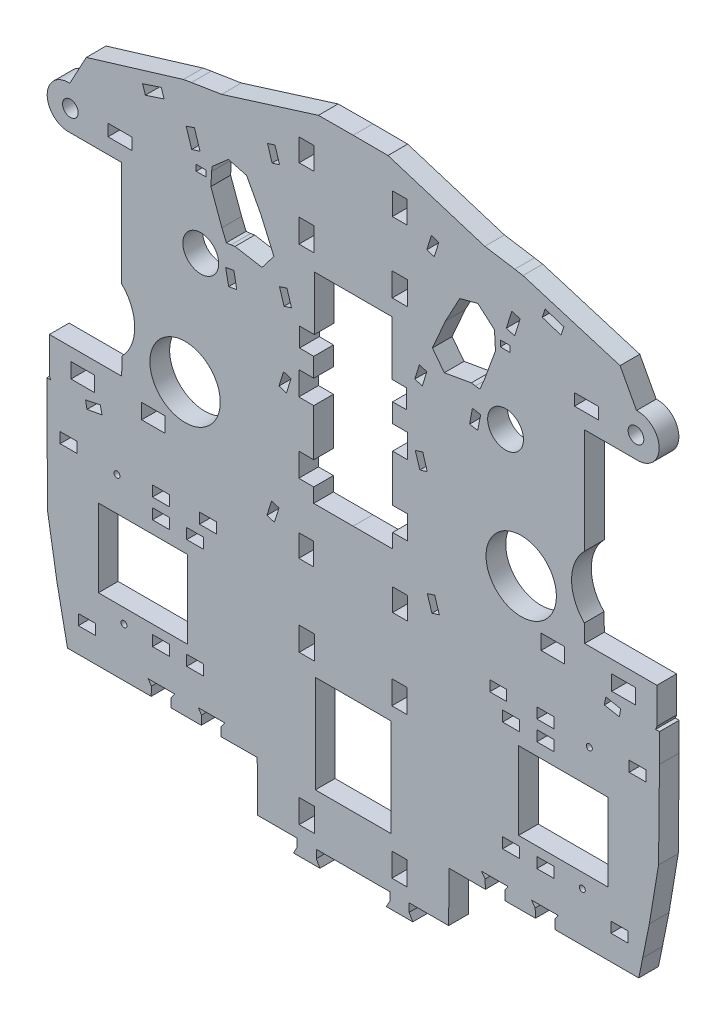
from build123d import *

# Parameters (mm, degrees)
SKETCH_2_R      = 1.524028207
SKETCH_2_R_2    = 1.524027374
SKETCH_2_R_3    = 17.842909586
SKETCH_2_R_4    = 9.091693683
SKETCH_2_R_5    = 3.983277078
SKETCH_2_W      = 7.746275654
SKETCH_2_H      = 11.929921146
SKETCH_2_W_2    = 45.296831888
SKETCH_2_H_2    = 39.444641114
SKETCH_2_W_3    = 8.608420335
SKETCH_2_H_3    = 5.341201782
SKETCH_2_W_4    = 8.608420334
SKETCH_2_W_5    = 8.607477859
SKETCH_2_H_4    = 5.341201591
SKETCH_2_W_6    = 7.740138654
SKETCH_2_H_5    = 11.92998218
SKETCH_2_W_7    = 7.574947328
SKETCH_2_H_6    = 11.290707347
SKETCH_2_W_8    = 7.56254503
SKETCH_2_H_7    = 11.342742621
SKETCH_2_W_9    = 7.686910794
SKETCH_2_H_8    = 11.900067324
SKETCH_2_W_10   = 12.085948944
SKETCH_2_H_9    = 5.956085206
SKETCH_2_W_11   = 4.99647522
SKETCH_2_H_10   = 3.050903321
SKETCH_2_W_12   = 11.949621596
SKETCH_2_H_11   = 7.665863511
SKETCH_2_W_13   = 11.949633042
SKETCH_2_H_12   = 7.665848253
SKETCH_2_W_14   = 8.607477858
SKETCH_2_H_13   = 5.341186332
SKETCH_2_W_15   = 8.608417474
SKETCH_2_H_14   = 5.341201783
SKETCH_2_W_16   = 8.608422242
SKETCH_2_H_15   = 5.341217041
EXTRUDE_1_DEPTH = 10


with BuildPart() as part:
    # 草图2 → 凸台-拉伸1 (new body)
    with BuildSketch(Plane.XY):
        with BuildLine():
            Line((-23.822800503, 160.548129295), (-6.190551216, 160.469998017))
            Line((-6.190551216, 160.469998017), (42.918828773, 145.11721668))
            Line((42.918828773, 145.11721668), (58.16179658, 142.692780871))
            Line((58.16179658, 142.692780871), (62.277447711, 141.97052135))
            Line((62.277447711, 141.97052135), (111.525756846, 127.031648059))
            Line((111.525756846, 127.031648059), (119.880274883, 111.475863516))
            ThreePointArc((119.880274883, 111.475863516), (131.345243979, 101.119781607), (120.778835307, 89.848359485))
            Line((120.778835307, 89.848359485), (93.54940034, 89.848328967))
            Line((93.54940034, 89.848328967), (93.548393141, 36.53752583))
            ThreePointArc((93.548393141, 36.53752583), (86.941362822, 20.762533913), (93.394549494, 4.923985955))
            Line((93.394549494, 4.923985955), (93.562348321, -4.021783871))
            Line((93.562348321, -4.021783871), (130.21033346, -4.018366357))
            Line((130.21033346, -4.018366357), (130.212952509, -22.072321357))
            Line((130.212952509, -22.072321357), (129.546875223, -23.731296619))
            Line((129.546875223, -23.731296619), (131.514180644, -23.731296428))
            Line((131.514180644, -23.731296428), (131.514180644, -38.151767619))
            Line((131.514180644, -38.151767619), (131.045837619, -82.513126453))
            Line((131.045837619, -82.513126453), (126.374923942, -110.722286304))
            Line((126.374923942, -110.722286304), (123.012542975, -127.369731983))
            Line((123.012542975, -127.369731983), (121.005245468, -137.20229729))
            Line((121.005245468, -137.20229729), (78.570716348, -137.175716479))
            Line((78.570716348, -137.175716479), (78.449775186, -132.61648186))
            Line((78.449775186, -132.61648186), (80.068236788, -130.153133471))
            Line((80.068236788, -130.153133471), (66.616782684, -130.153621752))
            Line((66.616782684, -130.153621752), (68.492827903, -132.678737719))
            Line((68.492827903, -132.678737719), (68.603683005, -137.175716479))
            Line((68.603683005, -137.175716479), (53.17979868, -137.175716479))
            Line((53.17979868, -137.175716479), (53.058849889, -132.61648186))
            Line((53.058849889, -132.61648186), (54.677315306, -130.153133471))
            Line((54.677315306, -130.153133471), (41.22585603, -130.153619926))
            Line((41.22585603, -130.153619926), (43.101902606, -132.678737719))
            Line((43.101902606, -132.678737719), (43.212757708, -137.175716478))
            Line((43.212757708, -137.175716478), (24.793053351, -137.074138719))
            Line((24.793053351, -137.074138719), (24.579309343, -162.407596669))
            Line((24.579309343, -162.407596669), (4.586877135, -162.401526442))
            Line((4.586877135, -162.401526442), (4.588201611, -166.563696834))
            Line((4.588201611, -166.563696834), (6.405158477, -169.850209541))
            Line((6.405158477, -169.850209541), (-7.021925209, -169.851461562))
            Line((-7.021925209, -169.851461562), (-5.17591824, -166.564607274))
            Line((-5.17591824, -166.564607274), (-5.176306003, -162.406404255))
            Line((-5.176306003, -162.406404255), (-23.853856743, -162.412082662))
            Line((-23.853856743, -162.412082662), (-42.531406046, -162.402812144))
            Line((-42.531406046, -162.402812144), (-42.532593524, -166.561015012))
            Line((-42.532593524, -166.561015012), (-40.687218725, -169.848224267))
            Line((-40.687218725, -169.848224267), (-54.114301922, -169.844389918))
            Line((-54.114301922, -169.844389918), (-52.29671302, -166.558226712))
            Line((-52.29671302, -166.558226712), (-52.294588064, -162.396056652))
            Line((-52.294588064, -162.396056652), (-72.287021071, -162.398281887))
            Line((-72.287021071, -162.398281887), (-72.495892883, -137.064783298))
            Line((-72.495892883, -137.064783298), (-90.915616436, -137.162818534))
            Line((-90.915616436, -137.162818534), (-90.803896466, -132.665861177))
            Line((-90.803896466, -132.665861177), (-88.927364288, -130.141104237))
            Line((-88.927364288, -130.141104237), (-102.378823222, -130.138030765))
            Line((-102.378823222, -130.138030765), (-100.760831592, -132.601690375))
            Line((-100.760831592, -132.601690375), (-100.882657224, -137.160901649))
            Line((-100.882657224, -137.160901649), (-116.306541263, -137.157935291))
            Line((-116.306541263, -137.157935291), (-116.194821293, -132.660977934))
            Line((-116.194821293, -132.660977934), (-114.318290473, -130.136222819))
            Line((-114.318290473, -130.136222819), (-127.769744234, -130.133147523))
            Line((-127.769744234, -130.133147523), (-126.151756419, -132.596807132))
            Line((-126.151756419, -132.596807132), (-126.273574422, -137.156018407))
            Line((-126.273574422, -137.156018407), (-168.708107869, -137.174438108))
            Line((-168.708107869, -137.174438108), (-170.713514317, -127.341486934))
            Line((-170.713514317, -127.341486934), (-174.072693545, -110.693394902))
            Line((-174.072693545, -110.693394902), (-178.738181882, -82.483337252))
            Line((-178.738181882, -82.483337252), (-179.197993217, -38.121889166))
            Line((-179.197993217, -38.121889166), (-179.195219837, -23.701418241))
            Line((-179.195219837, -23.701418241), (-177.227914452, -23.701796788))
            Line((-177.227914452, -23.701796788), (-177.893672668, -22.042693456))
            Line((-177.893672668, -22.042693456), (-177.88758144, -3.988739294))
            Line((-177.88758144, -3.988739294), (-141.239597635, -3.999205036))
            Line((-141.239597635, -3.999205036), (-141.07007834, 4.946532354))
            ThreePointArc((-141.07007834, 4.946532354), (-134.61384568, 20.783838926), (-141.217841993, 36.560101231))
            Line((-141.217841993, 36.560101231), (-141.20859633, 89.870903576))
            Line((-141.20859633, 89.870903576), (-168.438030788, 89.876170924))
            ThreePointArc((-168.438030788, 89.876170924), (-179.002271518, 101.149624995), (-167.535310927, 111.503501742))
            Line((-167.535310927, 111.503501742), (-159.17780132, 127.057679236))
            Line((-159.17780132, 127.057679236), (-109.926620015, 141.987080699))
            Line((-109.926620015, 141.987080699), (-105.810830054, 142.708548675))
            Line((-105.810830054, 142.708548675), (-90.567396256, 145.130052875))
            Line((-90.567396256, 145.130052875), (-41.455064492, 160.473389095))
            Line((-41.455064492, 160.473389095), (-23.822800503, 160.548129295))
        make_face()
        with Locations((95.944187533, -48.381401713)):
            Circle(SKETCH_2_R, mode=Mode.SUBTRACT)
        with Locations((92.372552745, -112.313649812)):
            Circle(SKETCH_2_R_2, mode=Mode.SUBTRACT)
        with Locations((61.398994141, 9.525096803)):
            Circle(SKETCH_2_R_3, mode=Mode.SUBTRACT)
        with Locations((53.456577443, 70.011847492)):
            Circle(SKETCH_2_R_4, mode=Mode.SUBTRACT)
        with Locations((119.593151422, 100.6095415)):
            Circle(SKETCH_2_R_5, mode=Mode.SUBTRACT)
        with Locations((-167.250277308, 100.637124706)):
            Circle(SKETCH_2_R_5, mode=Mode.SUBTRACT)
        with Locations((-101.119589174, 70.026711721)):
            Circle(SKETCH_2_R_4, mode=Mode.SUBTRACT)
        with Locations((-109.073638682, 9.541489655)):
            Circle(SKETCH_2_R_3, mode=Mode.SUBTRACT)
        with Locations((-140.070629032, -112.291297798)):
            Circle(SKETCH_2_R_2, mode=Mode.SUBTRACT)
        with Locations((-143.629968151, -48.358363976)):
            Circle(SKETCH_2_R, mode=Mode.SUBTRACT)
        Polygon((-4.684790119, -87.134565817), (-43.00844546, -87.130880569), (-43.017957005, -136.587134627), (-4.684790119, -136.59082079), align=None, mode=Mode.SUBTRACT)
        Polygon((-4.141392702, 90.657386205), (-43.517649496, 90.661172673), (-43.525510394, 63.134590406), (-51.004613145, 63.13672625), (-51.007378282, 53.507454186), (-43.823201502, 53.440258978), (-43.825949302, 43.818261537), (-51.401949174, 43.820425052), (-51.405379499, 31.808424504), (-43.829379627, 31.806260989), (-43.836182591, 7.984260503), (-51.412173325, 8.018423605), (-51.415580232, -3.911576452), (-43.839586643, -3.93574004), (-43.841649065, -11.157739868), (-23.839312315, -11.161586765), (-3.836975195, -11.161586765), (-3.837648664, -3.939586675), (3.738349432, -3.91688012), (3.73723693, 8.013120372), (-3.838760233, 7.980414304), (-3.840981693, 31.802415657), (3.735018455, 31.803122138), (3.733898306, 43.815123123), (-3.842101841, 43.814416643), (-3.842999116, 53.436414434), (3.341190454, 53.502227963), (3.340277242, 63.13150038), (-4.138825782, 63.130802936), align=None, mode=Mode.SUBTRACT)
        with Locations((-0.346288359, -150.01270452)):
            Rectangle(SKETCH_2_W, SKETCH_2_H, mode=Mode.SUBTRACT)
        with Locations((82.70168967, -85.337406237)):
            Rectangle(SKETCH_2_W_2, SKETCH_2_H_2, mode=Mode.SUBTRACT)
        with Locations((56.255519931, -112.313648302)):
            Rectangle(SKETCH_2_W_3, SKETCH_2_H_3, mode=Mode.SUBTRACT)
        with Locations((73.621953952, -112.313648303)):
            Rectangle(SKETCH_2_W_4, SKETCH_2_H_3, mode=Mode.SUBTRACT)
        with Locations((111.216315217, -121.922054274)):
            Rectangle(SKETCH_2_W_5, SKETCH_2_H_4, mode=Mode.SUBTRACT)
        with Locations((-0.356417334, -74.299112321)):
            Rectangle(SKETCH_2_W_6, SKETCH_2_H_5, mode=Mode.SUBTRACT)
        with Locations((-0.04689755, -33.440234665)):
            Rectangle(SKETCH_2_W_7, SKETCH_2_H_6, mode=Mode.SUBTRACT)
        with Locations((-0.205112617, 140.41424932)):
            Rectangle(SKETCH_2_W_8, SKETCH_2_H_7, mode=Mode.SUBTRACT)
        with Locations((-0.191055228, 104.913948425)):
            Rectangle(SKETCH_2_W_9, SKETCH_2_H_8, mode=Mode.SUBTRACT)
        with Locations((94.462415706, 100.644273181)):
            Rectangle(SKETCH_2_W_10, SKETCH_2_H_9, mode=Mode.SUBTRACT)
        with Locations((53.289382945, 106.410218616)):
            Rectangle(SKETCH_2_W_11, SKETCH_2_H_10, mode=Mode.SUBTRACT)
        with Locations((77.444585685, -14.278513072)):
            Rectangle(SKETCH_2_W_12, SKETCH_2_H_11, mode=Mode.SUBTRACT)
        with Locations((113.290185502, -14.275178011)):
            Rectangle(SKETCH_2_W_13, SKETCH_2_H_12, mode=Mode.SUBTRACT)
        with Locations((120.463801292, -46.609165176)):
            Rectangle(SKETCH_2_W_14, SKETCH_2_H_13, mode=Mode.SUBTRACT)
        with Locations((73.621953953, -46.6091729)):
            Rectangle(SKETCH_2_W_3, SKETCH_2_H_3, mode=Mode.SUBTRACT)
        with Locations((49.748777959, -46.6091729)):
            Rectangle(SKETCH_2_W_15, SKETCH_2_H_14, mode=Mode.SUBTRACT)
        with Locations((56.25412852, -56.631885608)):
            Rectangle(SKETCH_2_W_16, SKETCH_2_H_15, mode=Mode.SUBTRACT)
        with Locations((73.621953953, -56.631885608)):
            Rectangle(SKETCH_2_W_3, SKETCH_2_H_15, mode=Mode.SUBTRACT)
        Polygon((39.415623904, 118.287727283), (30.217014931, 115.839451267), (23.005118538, 102.396029658), (16.357395748, 87.204857918), (22.402192671, 79.347570248), (36.088359843, 81.726167102), (38.147697459, 81.396211047), (40.462265025, 81.158479114), (42.753078471, 86.602845569), (48.328533183, 101.899384875), (47.964565288, 108.671388049), (47.72801591, 111.031037707), align=None, mode=Mode.SUBTRACT)
        Polygon((60.836003143, 122.143097709), (56.668867659, 123.591427632), (53.859390269, 114.647340198), (58.077968608, 113.322218932), align=None, mode=Mode.SUBTRACT)
        Polygon((19.611463268, 135.218619828), (15.841792796, 136.384314445), (13.519291024, 128.917028879), (17.301252442, 127.747569152), align=None, mode=Mode.SUBTRACT)
        Polygon((13.528375003, 75.375065245), (9.759551309, 76.540498012), (7.43620276, 69.073474295), (11.218164178, 67.904014569), align=None, mode=Mode.SUBTRACT)
        Polygon((40.837505351, 70.125794787), (36.656593333, 70.920594592), (35.229793559, 63.174439807), (39.317886363, 62.451600451), align=None, mode=Mode.SUBTRACT)
        Polygon((11.460343668, 39.043840438), (7.678452622, 37.873489594), (10.003149132, 30.405705933), (13.771040492, 31.572057669), align=None, mode=Mode.SUBTRACT)
        Polygon((17.553924393, -20.799593351), (13.772033347, -21.969946103), (16.096729789, -29.435728955), (19.866621243, -28.269377032), align=None, mode=Mode.SUBTRACT)
        Polygon((111.850545556, -23.562177536), (111.153683561, -27.39964488), (103.536788312, -26.013377019), (104.359889529, -22.047235793), align=None, mode=Mode.SUBTRACT)
        Polygon((-152.040605341, -22.022580015), (-159.531552587, -23.536081109), (-158.835428636, -27.373682405), (-151.218266917, -25.988879469), align=None, mode=Mode.SUBTRACT)
        Polygon((-67.548535275, -28.260971086), (-65.234401861, -20.791632326), (-61.45273597, -21.962712399), (-63.778868206, -29.428048022), align=None, mode=Mode.SUBTRACT)
        Polygon((-61.44144579, 31.579290192), (-59.129312017, 39.050628424), (-55.347646126, 37.879550259), (-57.673778814, 30.412213827), align=None, mode=Mode.SUBTRACT)
        Polygon((-86.982352361, 62.463745633), (-88.500495401, 70.138232084), (-84.319430603, 70.932227791), (-82.894120614, 63.185798744), align=None, mode=Mode.SUBTRACT)
        Polygon((-58.881582074, 67.910755444), (-61.190356006, 75.382250287), (-57.421308243, 76.546958204), (-55.099395812, 69.079487793), align=None, mode=Mode.SUBTRACT)
        Polygon((-64.953160971, 127.755478835), (-67.261934903, 135.226973678), (-63.492040312, 136.391943281), (-61.170974709, 128.924211184), align=None, mode=Mode.SUBTRACT)
        Polygon((-105.7326507, 113.337971157), (-108.488988731, 122.159380202), (-104.321574778, 123.606908665), (-101.513817589, 114.662281071), align=None, mode=Mode.SUBTRACT)
        Polygon((-95.383138839, 111.044799447), (-87.069351362, 118.299890229), (-77.871213418, 115.84984516), (-70.661902629, 102.405036791), (-64.017101564, 87.212586825), (-70.063409509, 79.35646185), (-83.74911897, 81.737690817), (-85.808520006, 81.408130825), (-88.12313325, 81.170844039), (-90.41289958, 86.615650968), (-95.985412322, 101.913262277), (-95.620142025, 108.685195326), align=None, mode=Mode.SUBTRACT)
        Polygon((-117.004598031, -53.943360108), (-117.005625267, -59.28457705), (-125.614045442, -59.282921458), (-125.613018207, -53.941704516), align=None, mode=Mode.SUBTRACT)
        Polygon((-99.636771966, -53.946700329), (-99.637799202, -59.287917272), (-108.246221284, -59.286261679), (-108.245194049, -53.945044737), align=None, mode=Mode.SUBTRACT)
        Polygon((-93.129496319, -43.925246561), (-93.130523551, -49.266448244), (-101.738940866, -49.264792653), (-101.737913633, -43.923590969), align=None, mode=Mode.SUBTRACT)
        Polygon((-117.002670441, -43.920655215), (-117.003697673, -49.261856899), (-125.612117849, -49.260201307), (-125.611090616, -43.918999623), align=None, mode=Mode.SUBTRACT)
        Polygon((-163.844988151, -43.91164639), (-163.846015381, -49.252832623), (-172.45349308, -49.251177212), (-172.452465851, -43.909990979), align=None, mode=Mode.SUBTRACT)
        Polygon((-154.993852842, -10.417029917), (-154.995327156, -18.082878028), (-166.944959976, -18.080579846), (-166.943485662, -10.414731735), align=None, mode=Mode.SUBTRACT)
        Polygon((-119.14826005, -10.427251259), (-119.149734367, -18.093114627), (-131.099355742, -18.090816447), (-131.097881425, -10.424953079), align=None, mode=Mode.SUBTRACT)
        Polygon((-98.446863516, 107.950021181), (-98.447450273, 104.899117917), (-103.4439254, 104.900078851), (-103.443338643, 107.950982115), align=None, mode=Mode.SUBTRACT)
        Polygon((-136.075988273, 103.643903532), (-136.077133761, 97.687818437), (-148.163082482, 97.690142836), (-148.161936993, 103.646227931), align=None, mode=Mode.SUBTRACT)
        Polygon((-43.620645389, 110.867788737), (-43.622934039, 98.967721633), (-51.30984469, 98.969199998), (-51.307556041, 110.869267102), align=None, mode=Mode.SUBTRACT)
        Polygon((-43.661996972, 146.089435884), (-43.664178435, 134.746693473), (-51.226723326, 134.74814792), (-51.224541862, 146.090890331), align=None, mode=Mode.SUBTRACT)
        Polygon((-43.847452001, -27.791033285), (-43.849623457, -39.081740423), (-51.424570644, -39.080283591), (-51.422399188, -27.789576453), align=None, mode=Mode.SUBTRACT)
        Polygon((-43.463133164, -68.330348188), (-43.465427567, -80.260330147), (-51.205566078, -80.258841545), (-51.203271675, -68.328859586), align=None, mode=Mode.SUBTRACT)
        Polygon((-154.6119866, -119.226304965), (-154.613013832, -124.567506457), (-163.220491532, -124.565851047), (-163.219464299, -119.224649554), align=None, mode=Mode.SUBTRACT)
        Polygon((-117.015306881, -109.625129403), (-117.016334114, -114.966331086), (-125.624754289, -114.964675494), (-125.623727056, -109.623473811), align=None, mode=Mode.SUBTRACT)
        Polygon((-99.64887318, -109.628469357), (-99.649900413, -114.96967104), (-108.258320588, -114.968015448), (-108.257293356, -109.626813765), align=None, mode=Mode.SUBTRACT)
        Polygon((-107.742369431, -65.598950251), (-107.749955519, -105.043590635), (-153.046786569, -105.03487904), (-153.039200481, -65.590238656), align=None, mode=Mode.SUBTRACT)
        Polygon((-43.484755063, -144.043968146), (-43.487049454, -155.973889072), (-51.233324965, -155.972399289), (-51.231030574, -144.042478364), align=None, mode=Mode.SUBTRACT)
        Polygon((81.572051536, 125.401399035), (72.059446345, 128.510407825), (73.505101674, 132.933665949), (83.017706865, 129.82465716), align=None, mode=Mode.SUBTRACT)
        Polygon((-129.224410096, 125.421669475), (-119.71120715, 128.52884872), (-121.135184837, 132.888619323), (-130.648387784, 129.781440079), align=None, mode=Mode.SUBTRACT)
    extrude(amount=EXTRUDE_1_DEPTH)


solid = part.part
